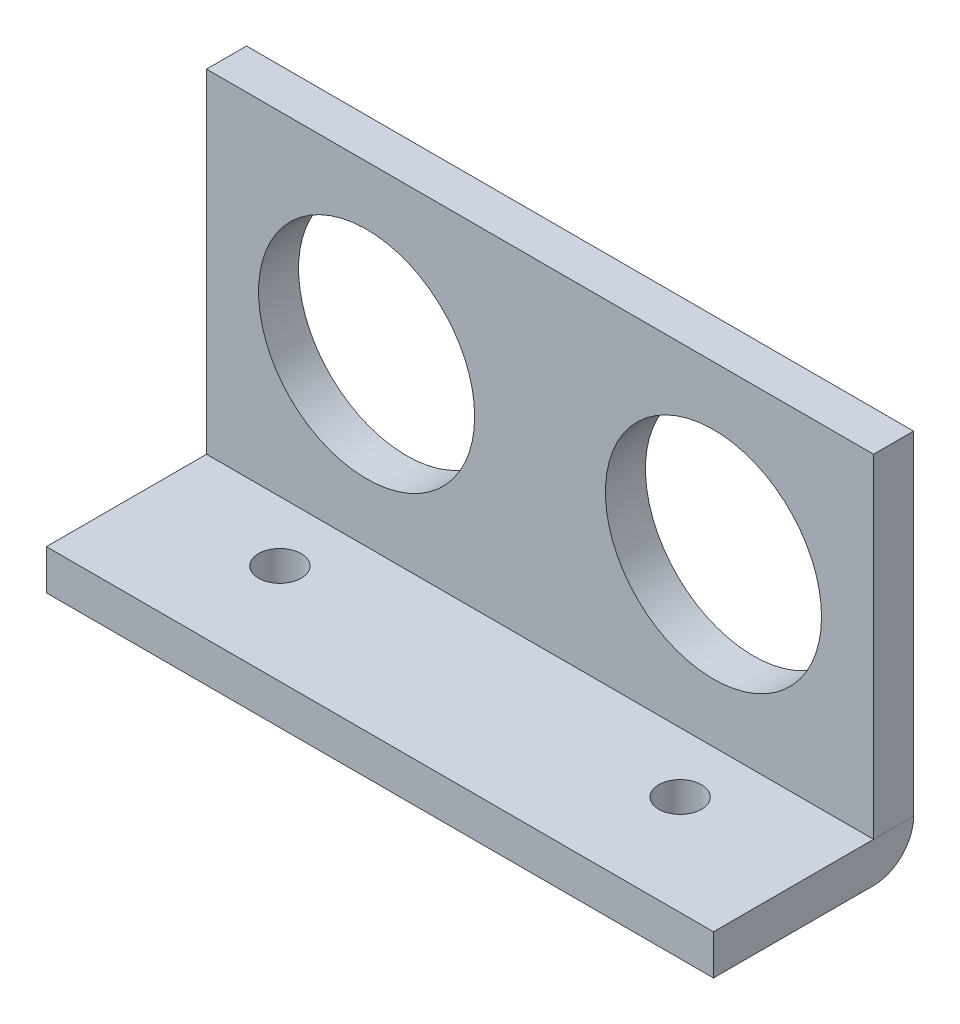
from build123d import *

# Parameters (mm, degrees)
SKETCH1_W           = 50
SKETCH1_H           = 15
SKETCH1_R           = 1.6
BOSS_EXTRUDE1_DEPTH = 3
SKETCH3_W           = 50
SKETCH3_H           = 3
BOSS_EXTRUDE3_DEPTH = 25
SKETCH4_R           = 8.1
CUT_EXTRUDE1_DEPTH  = 40.40812099
FILLET8_R           = 3


with BuildPart() as part:
    # Sketch1 → Boss-Extrude1 (new body)
    with BuildSketch(Plane(origin=(0, 0, 0), x_dir=(1, 0, 0), z_dir=(0, 1, 0))):
        Rectangle(SKETCH1_W, SKETCH1_H)
        with Locations(Location((-15, 0, 0), (0, 0, 270))):
            Circle(SKETCH1_R, mode=Mode.SUBTRACT)
        with Locations(Location((15, 0, 0), (0, 0, 270))):
            Circle(SKETCH1_R, mode=Mode.SUBTRACT)
    extrude(amount=BOSS_EXTRUDE1_DEPTH)

    # Fillet8
    fillet8_edges = [part.edges().sort_by_distance(p)[0] for p in [
        (0, 0, -7.5),
    ]]
    fillet(fillet8_edges, radius=FILLET8_R - 0.0001)  # a hair under: the kernel refuses the full size


with BuildPart() as body_2:
    # Sketch3 → Boss-Extrude3 (new body)
    with BuildSketch(Plane(origin=(0, 3, 0), x_dir=(1, 0, 0), z_dir=(0, 1, 0))):
        with Locations((0, 6)):
            Rectangle(SKETCH3_W, SKETCH3_H)
    extrude(amount=BOSS_EXTRUDE3_DEPTH)

    # Sketch4 → Cut-Extrude1 (cut, through all)
    with BuildSketch(Plane.XY.offset(-4.5)):
        with Locations((-13, 15.5)):
            Circle(SKETCH4_R)
        with Locations((13, 15.5)):
            Circle(SKETCH4_R)
    extrude(amount=-CUT_EXTRUDE1_DEPTH, mode=Mode.SUBTRACT)


solid = Compound([part.part, body_2.part])
